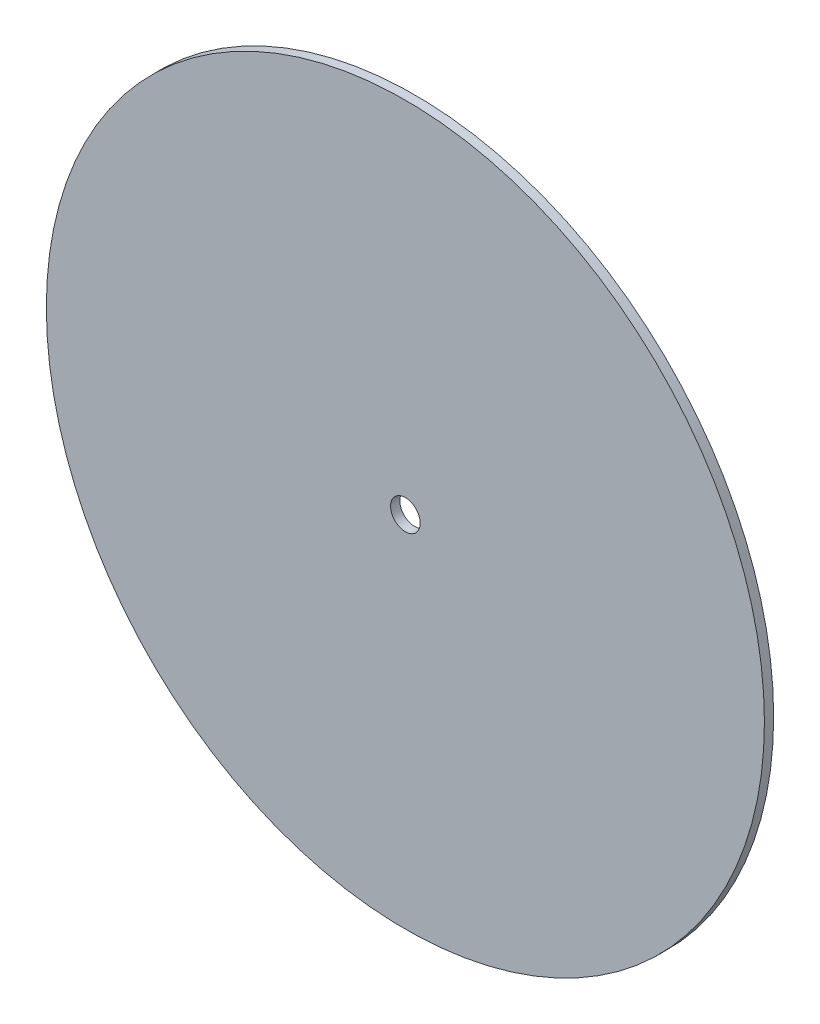
from build123d import *

# Parameters (mm, degrees)
ESQUISSE1_R        = 97
ESQUISSE1_R_2      = 4
BOSS_EXTRU_1_DEPTH = 2.5


with BuildPart() as part:
    # Esquisse1 → Boss.-Extru.1 (new body)
    with BuildSketch(Plane.XY):
        Circle(ESQUISSE1_R)
        Circle(ESQUISSE1_R_2, mode=Mode.SUBTRACT)
    extrude(amount=BOSS_EXTRU_1_DEPTH)


solid = part.part
